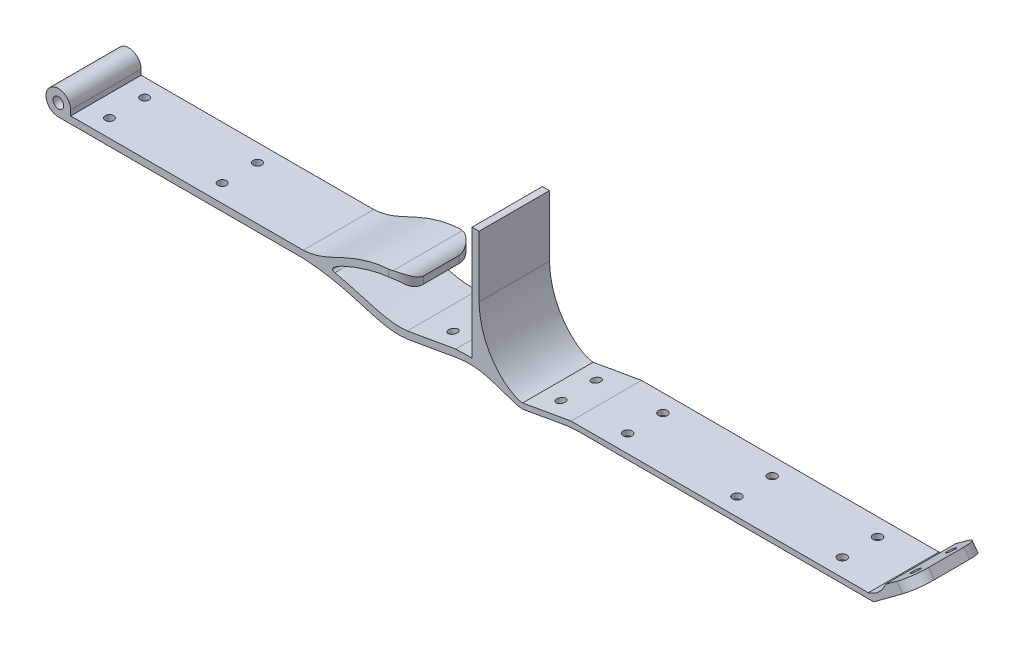
from build123d import *

# Parameters (mm, degrees)
EXTRUDE_1_OUTLINE_R = 1.5
EXTRUDE_1_DEPTH     = 20
SKETCH_2_R          = 1.25
SKETCH_2_R_2        = 1.2
CUT_EXTRUDE_1_DEPTH = 20
SKETCH_3_R          = 1.25
CUT_EXTRUDE_2_DEPTH = 20
SKETCH_4_R          = 1.25
CUT_EXTRUDE_3_DEPTH = 20
SKETCH_9_R          = 1.25
CUT_EXTRUDE_5_DEPTH = 245.986373256
CUT_EXTRUDE_START   = -1.5
SKETCH_10_R         = 2.5
CUT_EXTRUDE_6_DEPTH = 10
FILLET_1_R          = 5
FILLET_2_R          = 5


# Read off the part's stored shape, not the designer's step: Бобышка-Вытянуть1
with BuildPart() as part:
    # Бобышка-Вытянуть1 outline → Бобышка-Вытянуть1 (new body)
    with BuildSketch(Plane(origin=(0, 0, 0), x_dir=(-1, 0, 0), z_dir=(0, 0, 1))):
        with BuildLine():
            add(Edge.make_bspline(
                [(142.011622395, 8.05757382), (150.943794363, 9.416584141), (156.347843346, 3.869799571), (171.865909279, 3.010474878)],
                knots=[0, 0, 0, 0, 1, 1, 1, 1], degree=3))
            Line((142.011622395, 8.05757382), (128.224313853, 5.626499332))
            ThreePointArc((128.224313853, 5.626499332), (123.301480263, 5.375276698), (118.466716866, 6.335727769))
            Line((118.466716866, 6.335727769), (111.443450657, 8.660414355))
            ThreePointArc((111.443450657, 8.660414355), (110.234759808, 8.900527123), (109.004051411, 8.837721464))
            Line((109.004051411, 8.837721464), (98.330959593, 6.955767409))
            ThreePointArc((98.330959593, 6.955767409), (95.736186546, 6.614159057), (93.121514264, 6.5))
            Line((93.121514264, 6.5), (10, 6.5))
            Line((10, 6.5), (-2.209609181, -2.534635535))
            Line((-2.209609181, -2.534635535), (-0.594520503, -4.762877579))
            Line((-0.594520503, -4.762877579), (6.692574577, 0.519001376))
            add(Edge.make_bspline(
                [(11.5, 5), (8.033807528, 3.95772064), (6.692574577, 0.519001376)],
                knots=[0, 0, 0, 1, 1, 1], degree=2))
            Line((11.5, 5), (95.877407164, 5))
            Line((95.877407164, 5), (109.629533412, 7.424870899))
            add(Edge.make_bspline(
                [(122, -11.220033081), (121.726076148, 0.257528082), (113.91616074, 7.041533795), (109.629533412, 7.424870899)],
                knots=[0, 0, 0, 0, 1, 1, 1, 1], degree=3))
            Line((122, -11.220033081), (122, -28.57498627))
            Line((122, -28.57498627), (123.999999999, -28.57498627))
            Line((123.999999999, -28.57498627), (123.999999999, 3.566059351))
            Line((123.999999999, 3.566059351), (128.571610209, 3.656883826))
            Line((128.571610209, 3.656883826), (142.358918751, 6.087958314))
            add(Edge.make_bspline(
                [(142.358918751, 6.087958314), (148.572133876, 6.8101534), (154.583213425, 3.766911307), (162.894761518, 2.067564733)],
                knots=[0, 0, 0, 0, 0.753728725, 0.753728725, 0.753728725, 0.753728725], degree=3))
            add(Edge.make_bspline(
                [(146.535286779, -4.560587457), (151.960770454, -4.769826895), (166.805940444, 0.965293), (162.894761518, 2.067564733)],
                knots=[0, 0, 0, 0, 1, 1, 1, 1], degree=3))
            add(Edge.make_bspline(
                [(146.535286779, -4.560587457), (144.68273182, -4.545804635), (143.745407166, -2.992935642), (142.704459303, -2.750002164)],
                knots=[0, 0, 0, 0, 1, 1, 1, 1], degree=3))
            Line((142.704459303, -2.750002164), (142.704459303, -4.750002164))
            add(Edge.make_bspline(
                [(146.535286779, -6.560587457), (143.834904881, -6.577431366), (142.704459303, -4.750002164)],
                knots=[0, 0, 0, 1, 1, 1], degree=2))
            add(Edge.make_bspline(
                [(171.865909279, 1.010474878), (163.771404707, 0.58774305), (159.000482555, -5.884509042), (146.535286779, -6.560587457)],
                knots=[0, 0, 0, 0, 1, 1, 1, 1], degree=3))
            Line((171.865909279, 1.010474878), (237.865909279, 1.010478432))
            Line((237.865909279, 1.010478432), (237.867088713, -0.489522958))
            ThreePointArc((237.867088713, -0.489522958), (243.841958753, -2.964395162), (241.367086549, 3.010474878))
            Line((241.367086549, 3.010474878), (171.865909279, 3.010474878))
        make_face()
        with Locations((241.367086549, -0.489522958)):
            Circle(EXTRUDE_1_OUTLINE_R, mode=Mode.SUBTRACT)
    extrude(amount=EXTRUDE_1_DEPTH)

    # Эскиз2 → Вырез-Вытянуть1 (cut)
    with BuildSketch(Plane.XZ.offset(6.5)):
        with Locations((-84.8, 15)):
            Circle(SKETCH_2_R)
        with Locations((-84.8, 5)):
            Circle(SKETCH_2_R)
        with Locations((-53.8, 15)):
            Circle(SKETCH_2_R)
        with Locations(Location((-231.865909279, 15, 0), (0, 0, 90))):
            Circle(SKETCH_2_R_2)
        with Locations(Location((-231.865909279, 5, 0), (0, 0, 90))):
            Circle(SKETCH_2_R_2)
        with Locations(Location((-199.865909279, 5, 0), (0, 0, 90))):
            Circle(SKETCH_2_R_2)
        with Locations(Location((-199.865909279, 15, 0), (0, 0, 90))):
            Circle(SKETCH_2_R_2)
        with Locations((-23.901835852, 15)):
            Circle(SKETCH_2_R)
        with Locations((-23.901835852, 5)):
            Circle(SKETCH_2_R)
        with Locations((-53.8, 5)):
            Circle(SKETCH_2_R)
    extrude(amount=-CUT_EXTRUDE_1_DEPTH, mode=Mode.SUBTRACT)

    # Эскиз3 → Вырез-Вытянуть2 (cut)
    with BuildSketch(Plane(origin=(-229.245460819, -28.516386222, 0), x_dir=(0.9848077530144649, 0.1736481776541319, 0), z_dir=(-0.17364817765413187, 0.9848077530144648, 0))):
        with Locations(Location((127.461195894, -15, 0), (0, 0, 180))):
            Circle(SKETCH_3_R)
        with Locations(Location((127.461195894, -5, 0), (0, 0, 180))):
            Circle(SKETCH_3_R)
    extrude(amount=-CUT_EXTRUDE_2_DEPTH, mode=Mode.SUBTRACT)

    # Эскиз4 → Вырез-Вытянуть3 (cut)
    with BuildSketch(Plane(origin=(-2.904248106, 16.470809483, 0), x_dir=(0.9848077530122088, 0.17364817766692647, 0), z_dir=(0.17364817766692645, -0.9848077530122087, 0))):
        with Locations((-133.123329763, 15)):
            Circle(SKETCH_4_R)
        with Locations((-133.123329763, 5)):
            Circle(SKETCH_4_R)
    extrude(amount=-CUT_EXTRUDE_3_DEPTH, mode=Mode.SUBTRACT)

    # Эскиз9 → Вырез-Вытянуть5 (cut, through all)
    with BuildSketch(Plane(origin=(-2.058456242, 2.839929973, 0), x_dir=(0.8096772311060745, 0.5868754394489519, 0), z_dir=(-0.5868754394489519, 0.8096772311060745, 0))):
        with Locations(Location((-1.223414413, -5, 0), (0, 0, 180))):
            Circle(SKETCH_9_R)
        with Locations(Location((-1.223414413, -15, 0), (0, 0, 180))):
            Circle(SKETCH_9_R)
    extrude(amount=-CUT_EXTRUDE_5_DEPTH, mode=Mode.SUBTRACT)

    # Эскиз10 → Вырез-Вытянуть6 (cut)
    with BuildSketch(Plane(origin=(-2.058456242, 2.839929973, 0), x_dir=(0.8096772311060745, 0.5868754394489519, 0), z_dir=(-0.5868754394489519, 0.8096772311060745, 0)).offset(CUT_EXTRUDE_START)):
        with Locations(Location((-1.223414413, -5, 0), (0, 0, 180))):
            Circle(SKETCH_10_R)
        with Locations(Location((-1.223414413, -15, 0), (0, 0, 180))):
            Circle(SKETCH_10_R)
    extrude(amount=-CUT_EXTRUDE_6_DEPTH, mode=Mode.SUBTRACT)

    # Скругление1
    fillet_1_edges = [part.edges().sort_by_distance(p)[0] for p in [
        (-142.704459303, 3.750002164, 0),
        (-142.704459303, 3.750002164, 20),
    ]]
    fillet(fillet_1_edges, radius=FILLET_1_R)

    # Скругление2
    fillet_2_edges = [part.edges().sort_by_distance(p)[0] for p in [
        (1.402064842, 3.648756557, 0),
        (1.402064842, 3.648756557, 20),
    ]]
    fillet(fillet_2_edges, radius=FILLET_2_R)


solid = part.part
